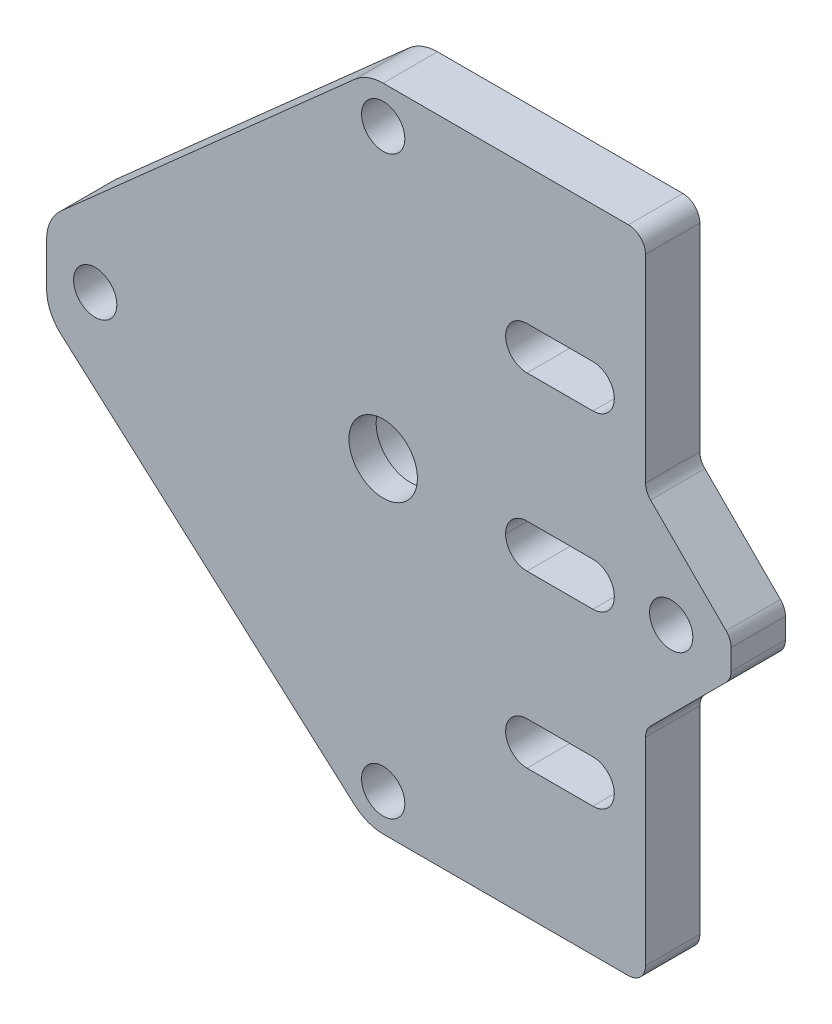
from build123d import *

# Parameters (mm, degrees)
SKETCH1_R                 = 4
SKETCH1_R_2               = 2.527736539
BOSS_EXTRUDE1_DEPTH       = 6.35
F_5_0MM_DOWEL_SLOT1_DEPTH = 6.35
SKETCH4_R                 = 4.926776695
CUT_EXTRUDE1_DEPTH        = 3.175


# Read off the part's stored shape, not the designer's step: Ø5.0mm Dowel Slot1
with BuildPart() as part:
    # Sketch1 → Boss-Extrude1 (new body)
    with BuildSketch(Plane.XY):
        with BuildLine():
            Line((8, -57.58012907), (-20.66, -57.58012907))
            ThreePointArc((-20.66, -57.58012907), (-22.435973202, -57.254090899), (-23.980332383, -56.318496743))
            Line((-23.980332383, -56.318496743), (-58.320332383, -25.818496743))
            ThreePointArc((-58.320332383, -25.818496743), (-59.560792799, -24.12931648), (-60, -22.08012907))
            Line((-60, -22.08012907), (-60, -17.08012907))
            ThreePointArc((-60, -17.08012907), (-59.560792799, -15.03094166), (-58.320332383, -13.341761396))
            Line((-58.320332383, -13.341761396), (-23.980332383, 17.158238604))
            ThreePointArc((-23.980332383, 17.158238604), (-22.435973202, 18.09383276), (-20.66, 18.41987093))
            Line((-20.66, 18.41987093), (8, 18.41987093))
            ThreePointArc((8, 18.41987093), (9.414213562, 17.834084493), (10, 16.41987093))
            Line((10, 16.41987093), (10, -6.725270109))
            ThreePointArc((10, -6.725270109), (10.152279768, -7.490730718), (10.585929943, -8.139627163))
            Line((10.585929943, -8.139627163), (19.414070057, -16.965975896))
            ThreePointArc((19.414070057, -16.965975896), (19.847720232, -17.614872341), (20, -18.38033295))
            Line((20, -18.38033295), (20, -20.77992519))
            ThreePointArc((20, -20.77992519), (19.847720232, -21.545385798), (19.414070057, -22.194282243))
            Line((19.414070057, -22.194282243), (10.585929943, -31.020630977))
            ThreePointArc((10.585929943, -31.020630977), (10.152279768, -31.669527422), (10, -32.43498803))
            Line((10, -32.43498803), (10, -55.58012907))
            ThreePointArc((10, -55.58012907), (9.414213562, -56.994342632), (8, -57.58012907))
        make_face()
        with Locations((-20.66, -19.58012907)):
            Circle(SKETCH1_R, mode=Mode.SUBTRACT)
        with Locations((-54.318282784, -19.58012907)):
            Circle(SKETCH1_R_2, mode=Mode.SUBTRACT)
        with Locations((-20.66, 14.050414337)):
            Circle(SKETCH1_R_2, mode=Mode.SUBTRACT)
        with Locations((12.998282784, -19.58012907)):
            Circle(SKETCH1_R_2, mode=Mode.SUBTRACT)
        with Locations((-20.66, -53.238409212)):
            Circle(SKETCH1_R_2, mode=Mode.SUBTRACT)
    extrude(amount=BOSS_EXTRUDE1_DEPTH)

    # Ø5.0mm Dowel Slot1 outline → Ø5.0mm Dowel Slot1 (cut)
    with BuildSketch(Plane.XY):
        with BuildLine():
            ThreePointArc((3.85, -22.567426083), (5.629646398, -21.823233219), (6.349772676, -20.033713042))
            ThreePointArc((6.349772676, -20.033713042), (5.629646398, -18.244192864), (3.85, -17.5))
            Line((3.85, -17.5), (-3.85, -17.5))
            ThreePointArc((-3.85, -17.5), (-5.629646398, -18.244192864), (-6.349772676, -20.033713042))
            ThreePointArc((-6.349772676, -20.033713042), (-5.629646398, -21.823233219), (-3.85, -22.567426083))
            Line((-3.85, -22.567426083), (3.85, -22.567426083))
        make_face()
        with BuildLine():
            Line((-3.85, -2.5), (3.85, -2.5))
            ThreePointArc((3.85, -2.5), (6.35, 0), (3.85, 2.5))
            Line((3.85, 2.5), (-3.85, 2.5))
            ThreePointArc((-3.85, 2.5), (-6.35, 0), (-3.85, -2.5))
        make_face()
        with BuildLine():
            Line((-3.85, -42.5), (3.85, -42.5))
            ThreePointArc((3.85, -42.5), (6.35, -40), (3.85, -37.5))
            Line((3.85, -37.5), (-3.85, -37.5))
            ThreePointArc((-3.85, -37.5), (-6.35, -40), (-3.85, -42.5))
        make_face()
    extrude(amount=F_5_0MM_DOWEL_SLOT1_DEPTH, mode=Mode.SUBTRACT)

    # Sketch4 → Cut-Extrude1 (cut)
    with BuildSketch(Plane(origin=(0, 0, 0), x_dir=(-1, 0, 0), z_dir=(0, 0, -1))):
        with Locations((20.66, -19.58012907)):
            Circle(SKETCH4_R)
    extrude(amount=-CUT_EXTRUDE1_DEPTH, mode=Mode.SUBTRACT)


solid = part.part
